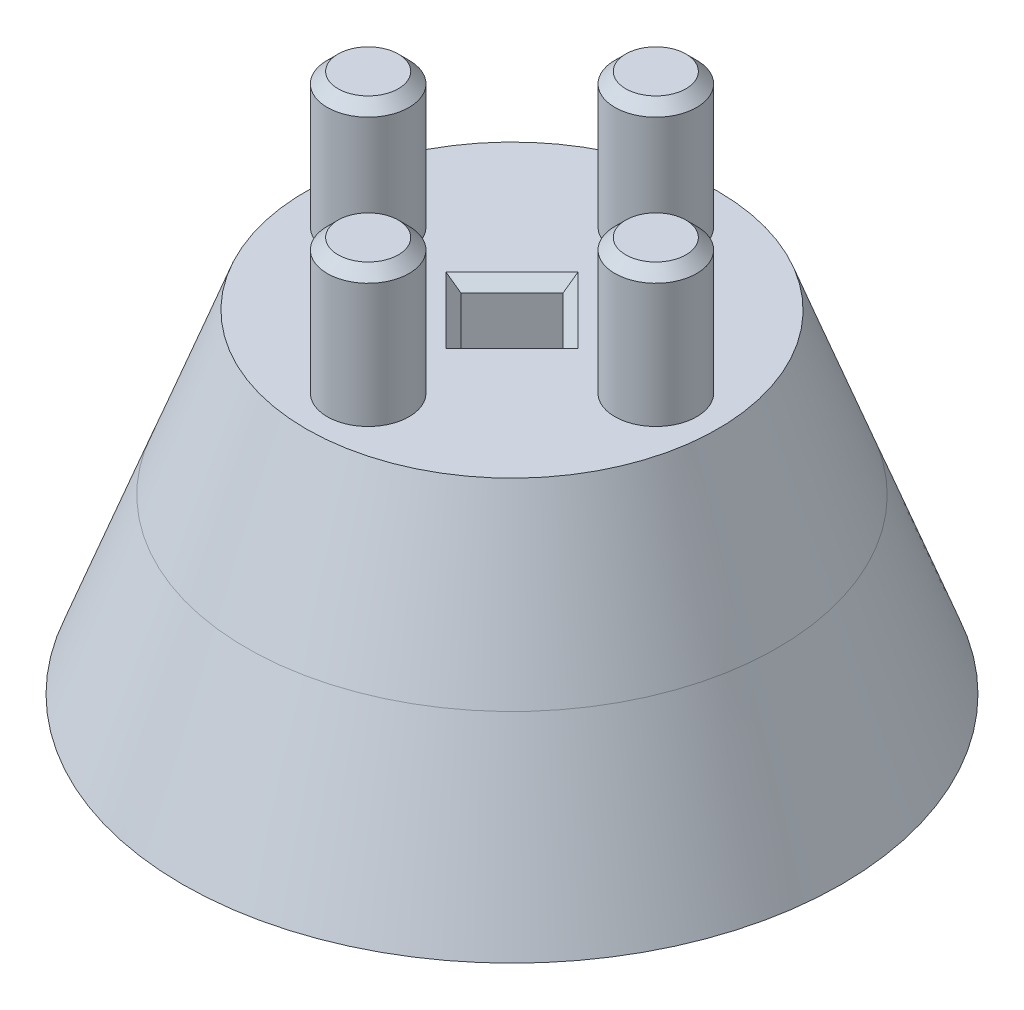
from build123d import *

# Parameters (mm, degrees)
CUT_EXTRUDE1_DEPTH  = 0.8
SKETCH3_R           = 21.299041780691258
SKETCH3_R_2         = 15
CUT_EXTRUDE2_DEPTH  = 1
CUT_EXTRUDE3_DEPTH  = 3.7
SKETCH4_3_R         = 2.6
CUT_EXTRUDE4_DEPTH  = 8.3
CUT_EXTRUDE5_DEPTH  = 28.928591200472848
SKETCH7_R           = 3.6000000000000014
SKETCH7_R_2         = 3.6
SKETCH7_R_3         = 3.5999999999999996
CUT_EXTRUDE6_DEPTH  = 1.5
SKETCH8_R           = 2.2750000000000004
SKETCH8_R_2         = 2.275
SKETCH8_R_3         = 2.2749999999999995
BOSS_EXTRUDE1_DEPTH = 7.5
CHAMFER1_SIZE       = 0.6
BOSS_EXTRUDE2_START = -0.2
SKETCH9_R           = 2.6
BOSS_EXTRUDE2_DEPTH = 0.2
CHAMFER2_SIZE       = 0.6
FILLET1_R           = 0.3
FILLET2_R           = 0.3
FILLET3_R           = 0.3
FILLET4_R           = 0.3
FILLET5_R           = 0.3


with BuildPart() as part:
    # Sketch1 → Revolve1 (revolve)
    with BuildSketch(Plane(origin=(0, 0, 0), x_dir=(0, 0, -1), z_dir=(1, 0, 0))):
        Polygon((0, 0), (0, 19.499999999999996), (11.45, 19.499999999999996), (18.7, 0), align=None)
    revolve(axis=Axis((0, 0, 0), (0, 1, 0)))

    # Sketch2 → Cut-Extrude1 (cut)
    with BuildSketch(Plane.XZ):
        with BuildLine():
            ThreePointArc((-4.999999999999996, 13.076696830622021), (-9.899494936611664, 9.899494936611665), (-13.07669683062202, 5.000000000000001))
            Line((-13.07669683062202, 5), (-4.9999999999999964, 5))
            Line((-4.999999999999997, 5), (-4.9999999999999964, 13.07669683062202))
        make_face()
        with BuildLine():
            Line((-4.000000000000001, 13.416407864998735), (-4.000000000000002, 5))
            Line((-4.000000000000002, 5), (4, 5))
            Line((4.000000000000002, 5), (4.000000000000001, 13.416407864998735))
            ThreePointArc((4.000000000000002, 13.416407864998735), (8.6e-16, 13.999999999999998), (-4.0000000000000036, 13.416407864998735))
        make_face()
        with BuildLine():
            Line((4.9999999999999964, 13.07669683062202), (4.999999999999997, 5))
            Line((4.9999999999999964, 5), (13.07669683062202, 5))
            ThreePointArc((13.07669683062202, 5), (9.899494936611662, 9.899494936611667), (4.999999999999997, 13.076696830622021))
        make_face()
        with BuildLine():
            Line((13.416407864998735, 4), (4.9999999999999964, 4))
            Line((4.999999999999997, 4), (4.999999999999999, -4))
            Line((5, -4), (13.416407864998728, -4))
            ThreePointArc((13.416407864998734, -4.000000000000007), (13.853333716293385, -2.021174150094161), (13.999999999999998, -3.43e-15))
            ThreePointArc((13.999999999999998, 0), (13.853333716293385, 2.021174150094156), (13.416407864998735, 4.000000000000001))
        make_face()
        Polygon((4.0000000000000036, 4), (-4.000000000000002, 4), (-4.0000000000000036, -4), (4.0000000000000036, -4), align=None)
        with BuildLine():
            Line((-4.9999999999999964, 4), (-13.416407864998735, 4))
            ThreePointArc((-13.416407864998734, 4.000000000000005), (-13.999999999999998, 1.71e-15), (-13.416407864998735, -4.000000000000003))
            Line((-13.416407864998728, -4), (-5, -4))
            Line((-4.999999999999999, -4), (-4.999999999999997, 4))
        make_face()
        with BuildLine():
            Line((-5, -5), (-13.076696830622012, -5))
            ThreePointArc((-13.076696830622017, -5.000000000000004), (-9.899494936611667, -9.899494936611664), (-5.000000000000008, -13.076696830622016))
            Line((-5, -13.07669683062202), (-4.999999999999999, -5))
        make_face()
        with BuildLine():
            Line((4.0000000000000036, -5), (-4.0000000000000036, -5))
            Line((-4.0000000000000036, -5), (-4.000000000000004, -13.416407864998735))
            ThreePointArc((-4.000000000000006, -13.416407864998734), (-2.57e-15, -13.999999999999998), (4.000000000000001, -13.416407864998735))
            Line((4.000000000000004, -13.416407864998735), (4.0000000000000036, -5))
        make_face()
        with BuildLine():
            Line((13.076696830622012, -5), (5, -5))
            Line((4.999999999999999, -5), (5, -13.07669683062202))
            ThreePointArc((5.0000000000000036, -13.076696830622017), (9.899494936611662, -9.899494936611667), (13.076696830622016, -5.000000000000009))
        make_face()
    extrude(amount=-CUT_EXTRUDE1_DEPTH, mode=Mode.SUBTRACT)

    # Sketch3 → Cut-Extrude2 (cut)
    with BuildSketch(Plane.XZ):
        Circle(SKETCH3_R)
        with Locations(Location((0, 0, 0), (0, 0, 270))):
            Circle(SKETCH3_R_2, mode=Mode.SUBTRACT)
    extrude(amount=-CUT_EXTRUDE2_DEPTH, mode=Mode.SUBTRACT)

    # Sketch4 → Cut-Extrude3 (cut)
    with BuildSketch(Plane.XZ.offset(-0.8)):
        with BuildLine():
            Line((-4.000000000000003, 5), (-0.5000000000001146, 5))
            Line((-0.5000000000001145, 5), (-0.5000000000001145, 6.434891306004865))
            ThreePointArc((-0.5000000000002117, 6.434891306004852), (-2.545584412271637, 7.454415587728494), (-3.5651086939951733, 9.499999999999972))
            Line((-3.5651086939951697, 9.5), (-4.000000000000004, 9.5))
            Line((-4.000000000000001, 9.5), (-4.000000000000003, 5))
        make_face()
        with BuildLine():
            Line((-0.5000000000001145, 13.565108693995134), (-0.5000000000001145, 13.991068579633216))
            ThreePointArc((-0.5000000000001135, 13.991068579633218), (-2.268272191390687, 13.815025923456087), (-4.000000000000001, 13.416407864998739))
            Line((-4, 13.416407864998737), (-4.000000000000001, 10.499999999999998))
            Line((-4.000000000000005, 10.499999999999998), (-3.5651086939951697, 10.499999999999998))
            ThreePointArc((-3.5651086939951737, 10.500000000000028), (-2.5455844122716376, 12.545584412271506), (-0.5000000000002139, 13.565108693995148))
        make_face()
        with BuildLine():
            Line((3.5651086939951835, 10.5), (3.999999999999991, 10.5))
            Line((4.000000000000002, 10.5), (4.000000000000001, 13.416407864998735))
            ThreePointArc((4.000000000000001, 13.416407864998735), (2.268272191390688, 13.815025923456083), (0.5000000000001148, 13.991068579633215))
            Line((0.5000000000001149, 13.991068579633216), (0.5000000000001149, 13.56510869399517))
            ThreePointArc((0.5000000000000878, 13.565108693995166), (2.54558441227161, 12.545584412271532), (3.565108693995181, 10.499999999999979))
        make_face()
        with BuildLine():
            Line((0.5000000000001146, 5), (4.000000000000003, 5))
            Line((4.000000000000003, 5), (4.000000000000002, 9.500000000000002))
            Line((3.999999999999992, 9.500000000000002), (3.5651086939951835, 9.500000000000002))
            ThreePointArc((3.565108693995181, 9.500000000000023), (2.5455844122716114, 7.4544155877284695), (0.5000000000000868, 6.434891306004834))
            Line((0.5000000000001149, 6.434891306004831), (0.5000000000001149, 5))
        make_face()
        with BuildLine():
            Line((4.999999999999998, 5), (13.07669683062202, 5))
            ThreePointArc((13.07669683062202, 5), (9.899494936611664, 9.899494936611665), (4.999999999999997, 13.076696830622021))
            Line((4.999999999999997, 13.076696830622021), (4.999999999999998, 5))
        make_face()
        with BuildLine():
            Line((-6.4348913060048165, 0.49999999999999656), (-4.999999999999998, 0.49999999999999656))
            Line((-4.999999999999998, 0.49999999999999645), (-4.999999999999998, 4))
            Line((-4.999999999999998, 4), (-9.500000000000002, 4))
            Line((-9.500000000000002, 3.999999999999991), (-9.500000000000002, 3.5651086939951817))
            ThreePointArc((-9.500000000000028, 3.565108693995178), (-7.454415587728431, 2.5455844122715705), (-6.434891306004819, 0.49999999999997563))
        make_face()
        with BuildLine():
            Line((-4.999999999999998, -4), (-4.999999999999998, -0.5000000000000173))
            Line((-4.999999999999998, -0.5000000000000173), (-6.434891306004819, -0.5000000000000173))
            ThreePointArc((-6.434891306004822, -0.4999999999999964), (-7.454415587728436, -2.5455844122715816), (-9.500000000000027, -3.5651086939951844))
            Line((-9.499999999999998, -3.565108693995188), (-9.499999999999998, -4.000000000000005))
            Line((-9.499999999999998, -3.9999999999999973), (-4.999999999999998, -4))
        make_face()
        with BuildLine():
            Line((-13.416407864998734, -3.9999999999999947), (-10.499999999999998, -3.9999999999999964))
            Line((-10.499999999999998, -4.000000000000006), (-10.499999999999998, -3.5651086939951537))
            ThreePointArc((-10.500000000000098, -3.565108693995167), (-12.545584412271591, -2.545584412271555), (-13.565108693995171, -0.5000000000000457))
            Line((-13.565108693995167, -0.5000000000000173), (-13.991068579633216, -0.5000000000000173))
            ThreePointArc((-13.991068579633218, -0.5000000000000172), (-13.815025923456089, -2.2682721913906367), (-13.416407864998734, -3.9999999999999933))
        make_face()
        with BuildLine():
            Line((-10.499999999999998, 3.565108693995147), (-10.499999999999998, 3.9999999999999902))
            Line((-10.499999999999998, 4), (-13.416407864998735, 4))
            ThreePointArc((-13.416407864998734, 3.9999999999999996), (-13.815025923456094, 2.268272191390629), (-13.99106857963322, 0.49999999999999745))
            Line((-13.991068579633216, 0.49999999999999656), (-13.56510869399517, 0.49999999999999656))
            ThreePointArc((-13.565108693995173, 0.5000000000000265), (-12.545584412271596, 2.5455844122715434), (-10.500000000000098, 3.565108693995161))
        make_face()
        Polygon((-0.5000000000001145, 3.7426406871191684), (-0.5000000000001145, 4), (-4.000000000000003, 4), (-4.000000000000003, 0.49999999999999645), (-3.742640687119284, 0.49999999999999656), align=None)
        Polygon((-3.7426406871192643, -0.5000000000000173), (-4.000000000000002, -0.5000000000000173), (-4.0000000000000036, -4), (-0.5000000000001146, -4), (-0.5000000000001145, -3.7426406871191755), align=None)
        Polygon((4.000000000000003, -4), (4.000000000000003, -0.5000000000000173), (3.742640687119275, -0.5000000000000173), (0.500000000000111, -3.7426406871191755), (0.5000000000001149, -3.9999999999999982), align=None)
        Polygon((4.000000000000003, 4), (0.500000000000115, 4), (0.5000000000001149, 3.7426406871191684), (3.742640687119293, 0.4999999999999934), (4.000000000000002, 0.49999999999999656), align=None)
        with BuildLine():
            Line((4.999999999999998, 4), (4.999999999999998, 0.49999999999999645))
            Line((4.999999999999998, 0.49999999999999656), (6.434891306004827, 0.49999999999999656))
            ThreePointArc((6.434891306004825, 0.5000000000000243), (7.454415587728401, 2.5455844122715443), (9.4999999999999, 3.565108693995164))
            Line((9.499999999999998, 3.5651086939951506), (9.499999999999998, 4.000000000000006))
            Line((9.499999999999998, 4), (4.999999999999998, 4))
        make_face()
        with BuildLine():
            Line((6.434891306004831, -0.5000000000000173), (4.999999999999998, -0.5000000000000173))
            Line((4.999999999999998, -0.5000000000000178), (4.999999999999998, -4))
            Line((4.999999999999998, -4), (9.500000000000002, -4))
            Line((9.500000000000002, -3.9999999999999902), (9.500000000000002, -3.5651086939951524))
            ThreePointArc((9.499999999999902, -3.5651086939951653), (7.454415587728409, -2.5455844122715536), (6.434891306004827, -0.5000000000000449))
        make_face()
        with BuildLine():
            Line((10.499999999999998, -3.565108693995187), (10.499999999999998, -3.9999999999999893))
            Line((10.499999999999998, -4), (13.416407864998728, -4))
            ThreePointArc((13.416407864998728, -3.9999999999999996), (13.815025923456087, -2.2682721913906385), (13.991068579633215, -0.5000000000000165))
            Line((13.991068579633216, -0.5000000000000173), (13.565108693995183, -0.5000000000000173))
            ThreePointArc((13.565108693995178, -0.49999999999999717), (12.545584412271563, -2.545584412271582), (10.49999999999997, -3.565108693995183))
        make_face()
        with BuildLine():
            Line((13.416407864998735, 4), (10.499999999999998, 4))
            Line((10.499999999999998, 4.000000000000007), (10.499999999999998, 3.5651086939951857))
            ThreePointArc((10.499999999999972, 3.565108693995182), (12.54558441227157, 2.545584412271573), (13.565108693995182, 0.49999999999997546))
            Line((13.565108693995183, 0.49999999999999656), (13.991068579633216, 0.49999999999999656))
            ThreePointArc((13.991068579633215, 0.49999999999999767), (13.81502592345609, 2.2682721913906287), (13.416407864998735, 4.000000000000001))
        make_face()
        with BuildLine():
            Line((4.999999999999998, -5), (5, -13.07669683062202))
            ThreePointArc((5, -13.07669683062202), (9.899494936611662, -9.899494936611667), (13.076696830622014, -5.000000000000008))
            Line((13.076696830622014, -5.000000000000008), (4.999999999999998, -5))
        make_face()
        with BuildLine():
            Line((4.000000000000003, -5), (0.500000000000115, -5))
            Line((0.5000000000001149, -4.999999999999998), (0.5000000000001149, -6.434891306004831))
            ThreePointArc((0.5000000000000878, -6.434891306004834), (2.5455844122716096, -7.454415587728468), (3.5651086939951804, -9.50000000000002))
            Line((3.565108693995183, -9.499999999999998), (4.000000000000005, -9.499999999999998))
            Line((4.0000000000000036, -9.499999999999998), (4.000000000000003, -5))
        make_face()
        with BuildLine():
            Line((-0.5000000000001145, -6.434891306004866), (-0.5000000000001145, -4.999999999999998))
            Line((-0.5000000000001146, -5), (-4.000000000000003, -5))
            Line((-4.000000000000003, -5), (-4.0000000000000036, -9.5))
            Line((-3.999999999999991, -9.5), (-3.5651086939951693, -9.5))
            ThreePointArc((-3.5651086939951733, -9.49999999999997), (-2.5455844122716367, -7.454415587728494), (-0.5000000000002139, -6.434891306004852))
        make_face()
        with BuildLine():
            Line((-3.56510869399517, -10.499999999999998), (-3.9999999999999902, -10.499999999999998))
            Line((-4.0000000000000036, -10.499999999999998), (-4.000000000000004, -13.416407864998735))
            ThreePointArc((-4.000000000000005, -13.416407864998739), (-2.2682721913906905, -13.815025923456089), (-0.5000000000001148, -13.991068579633222))
            Line((-0.5000000000001145, -13.991068579633216), (-0.5000000000001145, -13.565108693995134))
            ThreePointArc((-0.5000000000002117, -13.565108693995148), (-2.545584412271637, -12.545584412271506), (-3.5651086939951737, -10.500000000000025))
        make_face()
        with BuildLine():
            Line((4.000000000000004, -13.416407864998735), (4.0000000000000036, -10.499999999999996))
            Line((4.000000000000006, -10.499999999999996), (3.5651086939951835, -10.499999999999996))
            ThreePointArc((3.565108693995181, -10.499999999999977), (2.5455844122716114, -12.54558441227153), (0.5000000000000868, -13.565108693995166))
            Line((0.5000000000001149, -13.56510869399517), (0.5000000000001149, -13.991068579633216))
            ThreePointArc((0.5000000000001148, -13.991068579633222), (2.2682721913906914, -13.815025923456087), (4.000000000000006, -13.416407864998739))
        make_face()
        with BuildLine():
            Line((-4.999999999999998, -5), (-13.076696830622012, -5))
            ThreePointArc((-13.076696830622012, -5), (-9.899494936611664, -9.899494936611656), (-5.000000000000008, -13.076696830622014))
            Line((-5.000000000000008, -13.076696830622014), (-4.999999999999998, -5))
        make_face()
        with BuildLine():
            Line((-4.999999999999998, 5), (-4.9999999999999964, 13.07669683062202))
            ThreePointArc((-4.9999999999999964, 13.07669683062202), (-9.899494936611664, 9.899494936611665), (-13.07669683062202, 5.000000000000001))
            Line((-13.07669683062202, 5.000000000000001), (-4.999999999999998, 5))
        make_face()
    extrude(amount=-CUT_EXTRUDE3_DEPTH, mode=Mode.SUBTRACT)

    # Sketch4<3> → Cut-Extrude4 (cut)
    with BuildSketch(Plane.XZ.offset(-0.8)):
        with BuildLine():
            ThreePointArc((-2.551470164434615, 9.5), (-1.8384776310850754, 8.161522368915028), (-0.5000000000001429, 7.448529835565413))
            Line((-0.5000000000001145, 7.448529835565418), (-0.5000000000001145, 9.5))
            Line((-0.5000000000001146, 9.5), (-2.5514701644346145, 9.5))
        make_face()
        with BuildLine():
            Line((-2.5514701644346145, 9.5), (-0.5000000000001146, 9.5))
            Line((-0.5000000000001145, 9.5), (-0.5000000000001145, 10.499999999999998))
            Line((-0.5000000000001146, 10.499999999999998), (-2.551470164434615, 10.499999999999998))
            ThreePointArc((-2.551470164434615, 10.5), (-2.6, 10), (-2.551470164434615, 9.5))
        make_face()
        with BuildLine():
            Line((-2.551470164434615, 10.499999999999998), (-0.5000000000001146, 10.499999999999998))
            Line((-0.5000000000001145, 10.499999999999998), (-0.5000000000001145, 12.551470164434582))
            ThreePointArc((-0.5000000000001423, 12.551470164434587), (-1.8384776310850748, 11.838477631084972), (-2.551470164434615, 10.5))
        make_face()
        with BuildLine():
            Line((-0.5000000000001146, 10.499999999999998), (0.5000000000001146, 10.5))
            Line((0.5000000000001149, 10.5), (0.5000000000001149, 12.551470164434575))
            ThreePointArc((0.5000000000001635, 12.551470164434583), (1.113e-14, 12.6), (-0.5000000000001423, 12.551470164434587))
            Line((-0.5000000000001145, 12.551470164434582), (-0.5000000000001145, 10.499999999999998))
        make_face()
        with BuildLine():
            Line((0.5000000000001146, 10.5), (2.5514701644345994, 10.5))
            ThreePointArc((2.5514701644346074, 10.500000000000039), (1.8384776310850686, 11.838477631084979), (0.5000000000001635, 12.551470164434583))
            Line((0.5000000000001149, 12.551470164434575), (0.5000000000001149, 10.5))
        make_face()
        with BuildLine():
            Line((0.5000000000001146, 9.500000000000002), (2.5514701644346003, 9.500000000000002))
            ThreePointArc((2.5514701644346065, 9.49999999999996), (2.587839101212629, 9.748825187896932), (2.6, 10))
            ThreePointArc((2.6, 10), (2.587839101212629, 10.251174812103066), (2.5514701644346074, 10.500000000000039))
            Line((2.5514701644345994, 10.5), (0.5000000000001146, 10.5))
            Line((0.5000000000001149, 10.5), (0.5000000000001149, 9.500000000000002))
        make_face()
        Polygon((-0.5000000000001146, 9.5), (0.5000000000001146, 9.500000000000002), (0.5000000000001149, 10.5), (-0.5000000000001146, 10.499999999999998), align=None)
        with BuildLine():
            ThreePointArc((-0.5000000000001429, 7.448529835565413), (8.76e-15, 7.4), (0.5000000000001623, 7.448529835565417))
            Line((0.5000000000001149, 7.4485298355654255), (0.5000000000001149, 9.500000000000002))
            Line((0.5000000000001146, 9.500000000000002), (-0.5000000000001146, 9.5))
            Line((-0.5000000000001145, 9.5), (-0.5000000000001145, 7.448529835565418))
        make_face()
        with BuildLine():
            ThreePointArc((0.5000000000001623, 7.448529835565417), (1.8384776310850672, 8.16152236891502), (2.5514701644346065, 9.49999999999996))
            Line((2.5514701644346003, 9.500000000000002), (0.5000000000001146, 9.500000000000002))
            Line((0.5000000000001149, 9.500000000000002), (0.5000000000001149, 7.4485298355654255))
        make_face()
        with BuildLine():
            Line((10.499999999999998, 2.5514701644345963), (10.499999999999998, 0.49999999999999645))
            Line((10.499999999999998, 0.49999999999999656), (12.551470164434603, 0.49999999999999656))
            ThreePointArc((12.551470164434608, 0.5000000000000356), (11.838477631085027, 1.838477631085019), (10.500000000000048, 2.551470164434605))
        make_face()
        with BuildLine():
            Line((9.499999999999998, 2.551470164434604), (9.5, 0.49999999999999645))
            Line((9.499999999999998, 0.49999999999999656), (10.499999999999998, 0.49999999999999656))
            Line((10.499999999999998, 0.49999999999999645), (10.499999999999998, 2.5514701644345963))
            ThreePointArc((10.500000000000048, 2.551470164434605), (10.000000000000009, 2.5999999999999996), (9.49999999999997, 2.5514701644346087))
        make_face()
        with BuildLine():
            ThreePointArc((9.49999999999997, 2.5514701644346087), (8.161522368914966, 1.838477631085012), (7.448529835565385, 0.49999999999999833))
            Line((7.448529835565386, 0.49999999999999656), (9.499999999999998, 0.49999999999999656))
            Line((9.5, 0.49999999999999645), (9.499999999999998, 2.551470164434604))
        make_face()
        with BuildLine():
            Line((9.499999999999998, 0.49999999999999656), (7.448529835565386, 0.49999999999999656))
            ThreePointArc((7.448529835565385, 0.49999999999999833), (7.4, -9.41e-15), (7.448529835565388, -0.500000000000018))
            Line((7.448529835565386, -0.5000000000000173), (9.499999999999998, -0.5000000000000173))
            Line((9.5, -0.5000000000000169), (9.5, 0.49999999999999645))
        make_face()
        with BuildLine():
            Line((9.499999999999998, -0.5000000000000173), (7.448529835565386, -0.5000000000000173))
            ThreePointArc((7.448529835565388, -0.500000000000018), (8.161522368914973, -1.8384776310850204), (9.499999999999973, -2.55147016443461))
            Line((9.500000000000002, -2.5514701644346056), (9.5, -0.5000000000000169))
        make_face()
        with BuildLine():
            Line((10.499999999999998, -0.5000000000000173), (9.499999999999998, -0.5000000000000173))
            Line((9.5, -0.5000000000000169), (9.500000000000002, -2.5514701644346056))
            ThreePointArc((9.499999999999973, -2.55147016443461), (10.000000000000009, -2.6000000000000005), (10.500000000000046, -2.551470164434606))
            Line((10.499999999999998, -2.5514701644345976), (10.499999999999998, -0.5000000000000178))
        make_face()
        with BuildLine():
            Line((12.551470164434596, -0.5000000000000173), (10.499999999999998, -0.5000000000000173))
            Line((10.499999999999998, -0.5000000000000178), (10.499999999999998, -2.5514701644345976))
            ThreePointArc((10.500000000000046, -2.551470164434606), (11.838477631085018, -1.8384776310850295), (12.551470164434603, -0.5000000000000596))
        make_face()
        Polygon((10.499999999999998, 0.49999999999999656), (9.499999999999998, 0.49999999999999656), (9.5, -0.5000000000000169), (10.499999999999998, -0.5000000000000173), align=None)
        with BuildLine():
            Line((12.551470164434603, 0.49999999999999656), (10.499999999999998, 0.49999999999999656))
            Line((10.499999999999998, 0.49999999999999645), (10.499999999999998, -0.5000000000000178))
            Line((10.499999999999998, -0.5000000000000173), (12.551470164434596, -0.5000000000000173))
            ThreePointArc((12.551470164434603, -0.5000000000000596), (12.587839101212628, -0.25117481210307757), (12.6, -1.13e-15))
            ThreePointArc((12.6, -4.9e-16), (12.58783910121263, 0.2511748121030646), (12.551470164434608, 0.5000000000000357))
        make_face()
        with Locations(Location((0, -10, 0), (0, 0, 270))):
            Circle(SKETCH4_3_R)
        with Locations(Location((-10, -2.94e-15, 0), (0, 0, 270))):
            Circle(SKETCH4_3_R)
        Polygon((0, 2.82842712474619), (-2.82842712474619, 0), (8.7e-16, -2.8284271247461903), (2.828427124746191, -4.3e-16), align=None)
    extrude(amount=-CUT_EXTRUDE4_DEPTH, mode=Mode.SUBTRACT)

    # Sketch6 → Cut-Extrude5 (cut, through all)
    with BuildSketch(Plane.XZ.offset(-9.1)):
        Polygon((2.828427124746191, -4.3e-16), (0, 2.82842712474619), (-2.82842712474619, 0), (8.7e-16, -2.8284271247461903), align=None)
    extrude(amount=-CUT_EXTRUDE5_DEPTH, mode=Mode.SUBTRACT)

    # Sketch7 → Cut-Extrude6 (cut)
    with BuildSketch(Plane.XZ.offset(-9.1)):
        with Locations(Location((10, -4.9e-16, 0), (0, 0, 270))):
            Circle(SKETCH7_R)
        with Locations(Location((0, 10, 0), (0, 0, 270))):
            Circle(SKETCH7_R_2)
        with Locations(Location((-10, -2.94e-15, 0), (0, 0, 270))):
            Circle(SKETCH7_R_3)
        with Locations(Location((0, -10, 0), (0, 0, 270))):
            Circle(SKETCH7_R_2)
    extrude(amount=-CUT_EXTRUDE6_DEPTH, mode=Mode.SUBTRACT)


with BuildPart() as body_2:
    # Split1: the piece on the far side of the plane
    add(part.part)
    split(bisect_by=Plane(origin=(0, 10.6, 0), x_dir=(0, 0, -1), z_dir=(0, -1, 0)), keep=Keep.BOTTOM)

    # Sketch8 → Boss-Extrude1 (add)
    with BuildSketch(Plane(origin=(0, 19.499999999999996, 0), x_dir=(1, 0, 0), z_dir=(0, 1, 0))):
        with Locations(Location((0, 8, 0), (0, 0, 270))):
            Circle(SKETCH8_R)
        with Locations(Location((-8, 0, 0), (0, 0, 270))):
            Circle(SKETCH8_R_2)
        with Locations(Location((8, 0, 0), (0, 0, 270))):
            Circle(SKETCH8_R_3)
        with Locations(Location((0, -8, 0), (0, 0, 270))):
            Circle(SKETCH8_R_2)
    extrude(amount=BOSS_EXTRUDE1_DEPTH)

    # Chamfer1
    chamfer1_edges = [body_2.edges().sort_by_distance(p)[0] for p in [
        (7e-16, 26.999999999999996, -10.275),
        (-7.999999999999999, 26.999999999999996, -2.275),
        (8, 26.999999999999996, -2.2749999999999995),
        (7e-16, 26.999999999999996, 5.725),
        (1.4142135623730958, 19.499999999999996, -1.4142135623730954),
        (1.4142135623730951, 19.499999999999996, 1.414213562373095),
        (-1.4142135623730951, 19.5, 1.414213562373095),
        (-1.4142135623730945, 19.499999999999996, -1.4142135623730954),
        (1.4142135623730951, 10.6, 1.414213562373095),
        (1.4142135623730958, 10.6, -1.4142135623730954),
        (-1.4142135623730945, 10.6, -1.4142135623730954),
        (-1.4142135623730951, 10.6, 1.414213562373095),
    ]]
    chamfer(chamfer1_edges, length=CHAMFER1_SIZE)


with BuildPart() as part_1:
    add(part.part)

    # Split1
    split(bisect_by=Plane(origin=(0, 10.6, 0), x_dir=(0, 0, -1), z_dir=(0, -1, 0)), keep=Keep.TOP)

    # Sketch9 → Boss-Extrude2 (add)
    with BuildSketch(Plane(origin=(0, 9.1, 0), x_dir=(1, 0, 0), z_dir=(0, 1, 0)).offset(BOSS_EXTRUDE2_START)):
        with Locations(Location((0, -10, 0), (0, 0, 90))):
            Circle(SKETCH9_R)
        with Locations(Location((-10, 2.94e-15, 0), (0, 0, 90))):
            Circle(SKETCH9_R)
        with Locations(Location((0, 10, 0), (0, 0, 90))):
            Circle(SKETCH9_R)
        with Locations(Location((10, 4.9e-16, 0), (0, 0, 90))):
            Circle(SKETCH9_R)
    extrude(amount=BOSS_EXTRUDE2_DEPTH)

    # Chamfer2
    chamfer2_edges = [part_1.edges().sort_by_distance(p)[0] for p in [
        (-1.4142135623730951, 10.6, 1.414213562373095),
        (-1.4142135623730945, 10.6, -1.4142135623730954),
        (1.4142135623730958, 10.6, -1.4142135623730954),
        (1.4142135623730951, 10.6, 1.414213562373095),
    ]]
    chamfer(chamfer2_edges, length=CHAMFER2_SIZE)

    # Fillet1
    fillet1_edges = [part_1.edges().sort_by_distance(p)[0] for p in [
        (13.07669683062202, 2.25, 5),
        (4.999999999999997, 2.25, 5),
        (4.9999999999999964, 2.25, 13.076696830622021),
        (-13.076696830622014, 2.25, -5.000000000000002),
        (-4.999999999999999, 2.25, -5),
        (-5.000000000000007, 2.25, -13.076696830622017),
        (5.000000000000001, 2.25, -13.07669683062202),
        (4.999999999999999, 2.25, -5),
        (13.076696830622016, 2.25, -5.000000000000006),
        (-4.9999999999999964, 2.25, 13.07669683062202),
        (-4.999999999999997, 2.25, 5),
        (-13.07669683062202, 2.25, 5.000000000000002),
    ]]
    fillet(fillet1_edges, radius=FILLET1_R)

    # Fillet2
    fillet2_edges = [part_1.edges().sort_by_distance(p)[0] for p in [
        (3.7426406871192945, 2.6500000000000004, 0.499999999999995),
        (0.5000000000001166, 2.6500000000000004, 3.7426406871191684),
        (0.500000000000113, 2.6500000000000004, -3.7426406871191755),
        (3.7426406871192732, 2.6500000000000004, -0.5000000000000162),
        (-0.5000000000001126, 2.6500000000000004, -3.7426406871191746),
        (-3.7426406871192652, 2.6500000000000004, -0.500000000000018),
        (-0.5000000000001152, 2.6500000000000004, 3.7426406871191684),
        (-3.7426406871192843, 2.6500000000000004, 0.4999999999999983),
        (-4.0000000000000036, 2.6500000000000004, 10.499999999999998),
        (-0.500000000000114, 2.6500000000000004, 13.991068579633218),
        (0.5000000000001148, 2.6500000000000004, 13.991068579633218),
        (3.9999999999999964, 2.6500000000000004, 10.5),
        (0.5000000000001011, 2.6500000000000004, 6.4348913060048325),
        (3.999999999999997, 2.6500000000000004, 9.500000000000002),
        (0.5000000000001148, 2.6500000000000004, 5),
        (4.000000000000002, 2.25, 5),
        (-4.000000000000002, 2.25, 5),
        (4.000000000000005, 2.6500000000000004, -10.499999999999996),
        (0.5000000000001149, 2.6500000000000004, -13.991068579633218),
        (-0.5000000000001148, 2.6500000000000004, -13.991068579633218),
        (-3.999999999999997, 2.6500000000000004, -10.499999999999998),
        (-0.5000000000001643, 2.6500000000000004, -6.434891306004859),
        (-3.9999999999999973, 2.6500000000000004, -9.5),
        (-0.5000000000001146, 2.6500000000000004, -4.999999999999999),
        (0.5000000000001014, 2.6500000000000004, -6.4348913060048325),
        (0.500000000000115, 2.6500000000000004, -4.999999999999999),
        (4.000000000000004, 2.6500000000000004, -9.499999999999998),
        (-0.5000000000001631, 2.6500000000000004, 6.434891306004859),
        (-0.5000000000001146, 2.6500000000000004, 5),
        (-4.000000000000003, 2.6500000000000004, 9.5),
    ]]
    fillet(fillet2_edges, radius=FILLET2_R)

    # Fillet3
    fillet3_edges = [part_1.edges().sort_by_distance(p)[0] for p in [
        (10.499999999999998, 2.6500000000000004, 4.0000000000000036),
        (13.991068579633215, 2.6500000000000004, 0.4999999999999971),
        (13.991068579633218, 2.6500000000000004, -0.5000000000000169),
        (10.499999999999998, 2.6500000000000004, -3.9999999999999947),
        (6.434891306004829, 2.6500000000000004, -0.5000000000000309),
        (9.500000000000002, 2.6500000000000004, -3.999999999999995),
        (4.999999999999998, 2.6500000000000004, -0.5000000000000175),
        (6.434891306004826, 2.6500000000000004, 0.5000000000000104),
        (4.999999999999998, 2.6500000000000004, 0.4999999999999965),
        (9.499999999999998, 2.6500000000000004, 4.0000000000000036),
        (-13.991068579633218, 2.6500000000000004, 0.49999999999999695),
        (-10.499999999999998, 2.6500000000000004, 3.999999999999995),
        (-10.499999999999998, 2.6500000000000004, -4.000000000000002),
        (-13.991068579633218, 2.6500000000000004, -0.5000000000000173),
        (-6.43489130600482, 2.6500000000000004, -0.5000000000000069),
        (-4.999999999999998, 2.6500000000000004, -0.5000000000000173),
        (-9.499999999999998, 2.6500000000000004, -4.000000000000002),
        (-6.434891306004818, 2.6500000000000004, 0.4999999999999862),
        (-9.500000000000002, 2.6500000000000004, 3.9999999999999956),
        (-4.999999999999998, 2.6500000000000004, 0.4999999999999965),
    ]]
    fillet(fillet3_edges, radius=FILLET3_R)

    # Fillet4
    # the kernel refuses this fillet: 0.3 mm, written as the material it adds along each edge
    with BuildSketch(Plane(origin=(9.499999999999952, 0.8, -3.5651086939951586), x_dir=(3.5556e-13, 0, -1), z_dir=(0, 1, 0))) as fillet4_piece_1:
        with BuildLine():
            CenterArc((0.25734098550218165, 0.27387237171901635), FILLET4_R, 191.44509533034562, 54.4652521334346)
            Line((-0.03669360522836911, 0.21434372774052984), (-0.04257429704297995, 0.21315315486096062))
            ThreePointArc((-0.04257429704297995, 0.21315315486096062), (-0.02264194348097535, 0.10643657665179956), (-0.005941847823325, -0.00083333333333469))
            Line((-0.005941847823325, -0.00083333333333469), (2.13e-15, -0.00600000000000023))
            ThreePointArc((2.13e-15, -0.00600000000000023), (0.06744565300242336, -0.00600000000002598), (0.13244231241489562, -0.00547744743438104))
            Line((0.13244231241489562, -0.00547744743438104), (0.13489130600484245, 0))
        make_face()
    extrude(amount=4.243654613968981)
    with BuildSketch(Plane(origin=(10.499999999999984, 0.8, -3.5651086939951853), x_dir=(0.985661310660605, 0, 0.16873583101054226), z_dir=(0, 1, 0))) as fillet4_piece_2:
        with BuildLine():
            CenterArc((0.22652275582047254, 0.2998631352896731), FILLET4_R, 213.80397827418142, 54.46525213343466)
            Line((-0.02276099661480419, 0.13295714147343018), (-0.02774667166351041, 0.12961902159710517))
            ThreePointArc((-0.02774667166351041, 0.12961902159710517), (-0.01729446617135982, 0.06546615575065284), (-0.00591396786396385, -0.00101241498606329))
            Line((-0.00591396786396385, -0.00101241498606329), (0.00018121820465722, -0.00599726270579333))
            ThreePointArc((0.00018121820465722, -0.00599726270579333), (0.1087309227938315, -0.00435762347607877), (0.21728062738300397, -0.0059972627057932))
            Line((0.21728062738300397, -0.0059972627057932), (0.21746184558765977, 0))
        make_face()
    extrude(amount=4.24365461396915)
    with BuildSketch(Plane(origin=(13.565108693995182, 0.8, -0.5000000000000072), x_dir=(-0.1670356255158843, 0, -0.985950860747389), z_dir=(0, 1, 0))) as fillet4_piece_3:
        with BuildLine():
            CenterArc((0.21359318824959622, -0.29987831652170854), FILLET4_R, 91.63195241483183, 49.08852178944221)
            Line((-0.01862675997359392, -0.10994702461008386), (-0.02327115893805757, -0.10614839877185057))
            ThreePointArc((-0.02327115893805757, -0.10614839877185057), (-0.01522908515149616, -0.05397129855191113), (-0.00591570516448434, 0.00100221375309531))
            Line((-0.00591570516448434, 0.00100221375309531), (0.00017087455059968, 0.00599756633043327))
            ThreePointArc((0.00017087455059968, 0.00599756633043327), (0.10252473035981019, 0.00453979826049311), (0.20487858616902063, 0.0059975663304341))
            Line((0.20487858616902063, 0.0059975663304341), (0.20504946071962013, 1e-17))
        make_face()
    extrude(amount=4.21262365179905)
    with BuildSketch(Plane(origin=(13.565108693995182, 0.8, 0.4999999999999859), x_dir=(-0.16703562551585957, 0, 0.9859508607473932), z_dir=(0, 1, 0))) as fillet4_piece_4:
        with BuildLine():
            CenterArc((0.2135931882496007, 0.29987831652170804), FILLET4_R, 219.27952579572525, 49.08852178944176)
            Line((-0.01862675997359233, 0.10994702461008594), (-0.02327115893805608, 0.10614839877185277))
            ThreePointArc((-0.02327115893805608, 0.10614839877185277), (-0.01522908515149426, 0.0539712985519116), (-0.00591570516448436, -0.00100221375309516))
            Line((-0.00591570516448436, -0.00100221375309516), (0.00017087455059988, -0.00599756633043502))
            ThreePointArc((0.00017087455059988, -0.00599756633043502), (0.10252473035980876, -0.00453979826049051), (0.20487858616901894, -0.00599756633043409))
            Line((0.20487858616901894, -0.00599756633043409), (0.20504946071961858, 0))
        make_face()
    extrude(amount=4.2126236517990465)
    with BuildSketch(Plane(origin=(9.49999999999995, 0.8, 3.5651086939951577), x_dir=(-0.9856613106606169, 0, -0.16873583101047274), z_dir=(0, 1, 0))) as fillet4_piece_5:
        with BuildLine():
            CenterArc((0.22652275582042972, 0.29986313528967273), FILLET4_R, 213.80397827417707, 54.46525213343466)
            Line((-0.02276099661485906, 0.13295714147344917), (-0.02774667166356552, 0.1296190215971245))
            ThreePointArc((-0.02774667166356552, 0.1296190215971245), (-0.01729446617141888, 0.06546615575065759), (-0.00591396786396393, -0.00101241498606287))
            Line((-0.00591396786396393, -0.00101241498606287), (0.0001812182046568, -0.00599726270579335))
            ThreePointArc((0.0001812182046568, -0.00599726270579335), (0.1087309227937979, -0.00435762347607096), (0.21728062738293785, -0.00599726270579319))
            Line((0.21728062738293785, -0.00599726270579319), (0.21746184558759404, 0))
        make_face()
    extrude(amount=4.243654613968986)
    with BuildSketch(Plane(origin=(10.499999999999986, 0.8, 3.565108693995184), x_dir=(1.0535e-13, 0, 1), z_dir=(0, 1, 0))) as fillet4_piece_6:
        with BuildLine():
            CenterArc((0.2573409855022817, 0.27387237171895995), FILLET4_R, 191.44509533031922, 54.465252133434774)
            Line((-0.03669360522829652, 0.21434372774060892), (-0.04257429704290791, 0.21315315486104242))
            ThreePointArc((-0.04257429704290791, 0.21315315486104242), (-0.02264194348094584, 0.10643657665183842), (-0.00594184782332538, -0.00083333333333195))
            Line((-0.00594184782332538, -0.00083333333333195), (-6.3e-16, -0.00600000000000023))
            ThreePointArc((-6.3e-16, -0.00600000000000023), (0.06744565300240771, -0.0059999999999949), (0.13244231241486779, -0.00547744743437991))
            Line((0.13244231241486779, -0.00547744743437991), (0.13489130600481714, 0))
        make_face()
    extrude(amount=4.243654613969145)
    with BuildSketch(Plane(origin=(3.5651086939951826, 0.8, 10.49999999999999), x_dir=(-0.16873583101053505, 0, 0.9856613106606064), z_dir=(0, 1, 0))) as fillet4_piece_7:
        with BuildLine():
            CenterArc((0.22652275582047265, 0.29986313528967334), FILLET4_R, 213.80397827418037, 54.465252133435)
            Line((-0.02276099661480754, 0.1329571414734346), (-0.02774667166351379, 0.12961902159710958))
            ThreePointArc((-0.02774667166351379, 0.12961902159710958), (-0.01729446617136329, 0.06546615575065501), (-0.00591396786396386, -0.00101241498606325))
            Line((-0.00591396786396386, -0.00101241498606325), (0.00018121820465717, -0.00599726270579333))
            ThreePointArc((0.00018121820465717, -0.00599726270579333), (0.10873092279382943, -0.00435762347607812), (0.21728062738300008, -0.0059972627057932))
            Line((0.21728062738300008, -0.0059972627057932), (0.2174618455876559, 0))
        make_face()
    extrude(amount=4.24365461396914)
    with BuildSketch(Plane(origin=(3.5651086939951826, 0.8, 9.500000000000012), x_dir=(1, 0, -9.218e-14), z_dir=(0, 1, 0))) as fillet4_piece_8:
        with BuildLine():
            CenterArc((0.2573409855022785, 0.27387237171896334), FILLET4_R, 191.44509533031996, 54.4652521334354)
            Line((-0.0366936052282989, 0.21434372774060845), (-0.04257429704291027, 0.21315315486104183))
            ThreePointArc((-0.04257429704291027, 0.21315315486104183), (-0.02264194348094724, 0.10643657665183989), (-0.00594184782332537, -0.00083333333333203))
            Line((-0.00594184782332537, -0.00083333333333203), (-5.5e-16, -0.00600000000000023))
            ThreePointArc((-5.5e-16, -0.00600000000000023), (0.06744565300240957, -0.00599999999999579), (0.13244231241487098, -0.00547744743437994))
            Line((0.13244231241487098, -0.00547744743437994), (0.13489130600482024, 0))
        make_face()
    extrude(amount=4.243654613969144)
    with BuildSketch(Plane(origin=(-3.565108693995172, 0.8, 9.499999999999986), x_dir=(0.16873583101051104, 0, -0.9856613106606104), z_dir=(0, 1, 0))) as fillet4_piece_9:
        with BuildLine():
            CenterArc((0.22652275582045558, 0.2998631352896731), FILLET4_R, 213.8039782741787, 54.465252133435285)
            Line((-0.02276099661482894, 0.13295714147344215), (-0.02774667166353527, 0.1296190215971173))
            ThreePointArc((-0.02774667166353527, 0.1296190215971173), (-0.01729446617138711, 0.06546615575065648), (-0.00591396786396389, -0.0010124149860631))
            Line((-0.00591396786396389, -0.0010124149860631), (0.00018121820465703, -0.00599726270579334))
            ThreePointArc((0.00018121820465703, -0.00599726270579334), (0.10873092279381585, -0.00435762347607586), (0.21728062738297557, -0.0059972627057932))
            Line((0.21728062738297557, -0.0059972627057932), (0.21746184558763157, 0))
        make_face()
    extrude(amount=4.243654613969079)
    with BuildSketch(Plane(origin=(-3.565108693995172, 0.8, 10.500000000000014), x_dir=(0.16873583101050643, 0, 0.9856613106606111), z_dir=(0, 1, 0))) as fillet4_piece_10:
        with BuildLine():
            CenterArc((0.22652275582045325, -0.29986313528967273), FILLET4_R, 91.73076959238597, 54.465252133435314)
            Line((-0.02276099661483174, -0.13295714147344123), (-0.02774667166353809, -0.12961902159711639))
            ThreePointArc((-0.02774667166353809, -0.12961902159711639), (-0.01729446617138855, -0.06546615575065626), (-0.00591396786396389, 0.00101241498606308))
            Line((-0.00591396786396389, 0.00101241498606308), (0.000181218204657, 0.00599726270579334))
            ThreePointArc((0.000181218204657, 0.00599726270579334), (0.10873092279381576, 0.00435762347607593), (0.21728062738297357, 0.0059972627057932))
            Line((0.21728062738297357, 0.0059972627057932), (0.21746184558762957, 0))
        make_face()
    extrude(amount=4.243654613969074)
    with BuildSketch(Plane(origin=(0.5000000000001015, 0.8, 13.565108693995167), x_dir=(4.119765587946474e-12, 0, 1.0), z_dir=(0, 1, 0))) as fillet4_piece_11:
        with BuildLine():
            CenterArc((0.2599876124899218, 0.2606827499822643), FILLET4_R, 191.24746097498777, 49.08852178944409)
            Line((-0.03425056493216716, 0.20216869229244283), (-0.0401353284806089, 0.2009984111386464))
            ThreePointArc((-0.0401353284806089, 0.2009984111386464), (-0.02160130046863941, 0.10032603810408265), (-0.00594184782332784, -0.00083333333330904))
            Line((-0.00594184782332784, -0.00083333333330904), (-2.472e-14, -0.00600000000000001))
            ThreePointArc((-2.472e-14, -0.00600000000000001), (0.05575684802720475, -0.00600000000021628), (0.10854421772575212, -0.0052136549996453))
            Line((0.10854421772575212, -0.0052136549996453), (0.11151369605446071, 0))
        make_face()
    extrude(amount=4.2126236517990625)
    with BuildSketch(Plane(origin=(-0.5000000000001641, 0.8, 13.56510869399514), x_dir=(-0.9859508607473981, 0, -0.16703562551583043), z_dir=(0, 1, 0))) as fillet4_piece_12:
        with BuildLine():
            CenterArc((0.21359318824955967, 0.2998783165217077), FILLET4_R, 219.27952579571894, 49.088521789444485)
            Line((-0.01862675997365369, 0.10994702461011158), (-0.02327115893811806, 0.10614839877188025))
            ThreePointArc((-0.02327115893811806, 0.10614839877188025), (-0.01522908515155507, 0.0539712985519195), (-0.00591570516448439, -0.00100221375309498))
            Line((-0.00591570516448439, -0.00100221375309498), (0.00017087455059908, -0.00599756633043333))
            ThreePointArc((0.00017087455059908, -0.00599756633043333), (0.10252473035977876, -0.00453979826048418), (0.20487858616895863, -0.00599756633043412))
            Line((0.20487858616895863, -0.00599756633043412), (0.20504946071955865, 0))
        make_face()
    extrude(amount=4.212623651798896)
    with BuildSketch(Plane(origin=(-10.500000000000048, 0.8, -3.5651086939951604), x_dir=(-0.985661310660618, 0, 0.16873583101046616), z_dir=(0, 1, 0))) as fillet4_piece_13:
        with BuildLine():
            CenterArc((0.22652275582042794, -0.2998631352896724), FILLET4_R, 91.73076959238831, 54.465252133434106)
            Line((-0.02276099661485947, -0.1329571414734464), (-0.02774667166356596, -0.12961902159712177))
            ThreePointArc((-0.02774667166356596, -0.12961902159712177), (-0.01729446617141989, -0.06546615575065565), (-0.00591396786396393, 0.00101241498606284))
            Line((-0.00591396786396393, 0.00101241498606284), (0.00018121820465676, 0.00599726270579335))
            ThreePointArc((0.00018121820465676, 0.00599726270579335), (0.10873092279379605, 0.00435762347607155), (0.21728062738293574, 0.00599726270579319))
            Line((0.21728062738293574, 0.00599726270579319), (0.21746184558759202, 0))
        make_face()
    extrude(amount=4.24365461396898)
    with BuildSketch(Plane(origin=(-9.500000000000012, 0.8, -3.565108693995186), x_dir=(1.1852e-13, 0, -1), z_dir=(0, 1, 0))) as fillet4_piece_14:
        with BuildLine():
            CenterArc((0.2573409855022853, -0.27387237171895656), FILLET4_R, 114.08965253624737, 54.46525213343418)
            Line((-0.0366936052282937, -0.21434372774060942), (-0.0425742970429051, -0.21315315486104297))
            ThreePointArc((-0.0425742970429051, -0.21315315486104297), (-0.02264194348094443, -0.10643657665184049), (-0.0059418478233254, 0.00083333333333187))
            Line((-0.0059418478233254, 0.00083333333333187), (-7.1e-16, 0.00600000000000023))
            ThreePointArc((-7.1e-16, 0.00600000000000023), (0.0674456530024063, 0.00599999999999401), (0.13244231241486507, 0.00547744743437988))
            Line((0.13244231241486507, 0.00547744743437988), (0.13489130600481447, 0))
        make_face()
    extrude(amount=4.243654613969145)
    with BuildSketch(Plane(origin=(-13.56510869399517, 0.8, -0.5000000000000315), x_dir=(-1.0, 0, -3.859915704318083e-12), z_dir=(0, 1, 0))) as fillet4_piece_15:
        with BuildLine():
            CenterArc((0.2599876124898718, -0.26068274998229335), FILLET4_R, 119.66401723555681, 49.088521789442254)
            Line((-0.03425056493220371, -0.2021686922924044), (-0.04013532848064515, -0.20099841113860667))
            ThreePointArc((-0.04013532848064515, -0.20099841113860667), (-0.02160130046865305, -0.10032603810406349), (-0.00594184782332762, 0.00083333333331042))
            Line((-0.00594184782332762, 0.00083333333331042), (-2.316e-14, 0.00600000000000001))
            ThreePointArc((-2.316e-14, 0.00600000000000001), (0.05575684802720808, 0.00600000000022943), (0.10854421772575348, 0.00521365499964585))
            Line((0.10854421772575348, 0.00521365499964585), (0.11151369605446249, 0))
        make_face()
    extrude(amount=4.212623651798983)
    with BuildSketch(Plane(origin=(-13.565108693995171, 0.8, 0.5000000000000115), x_dir=(-1.0, 0, 3.8658892648613246e-12), z_dir=(0, 1, 0))) as fillet4_piece_16:
        with BuildLine():
            CenterArc((0.2599876124898751, 0.2606827499822909), FILLET4_R, 191.2474609750004, 49.0885217894417)
            Line((-0.03425056493220072, 0.20216869229240472), (-0.04013532848064217, 0.200998411138607))
            ThreePointArc((-0.04013532848064217, 0.200998411138607), (-0.02160130046865067, 0.10032603810406317), (-0.00594184782332763, -0.00083333333331038))
            Line((-0.00594184782332763, -0.00083333333331038), (-2.32e-14, -0.00600000000000001))
            ThreePointArc((-2.32e-14, -0.00600000000000001), (0.05575684802720627, -0.00600000000023054), (0.10854421772575168, -0.00521365499964583))
            Line((0.10854421772575168, -0.00521365499964583), (0.11151369605446071, 0))
        make_face()
    extrude(amount=4.212623651798983)
    with BuildSketch(Plane(origin=(-9.500000000000014, 0.8, 3.565108693995179), x_dir=(1.0535e-13, 0, 1), z_dir=(0, 1, 0))) as fillet4_piece_17:
        with BuildLine():
            CenterArc((0.2573409855022808, 0.2738723717189635), FILLET4_R, 191.44509533031922, 54.46525213343614)
            Line((-0.03669360522829741, 0.21434372774061247), (-0.0425742970429088, 0.21315315486104597))
            ThreePointArc((-0.0425742970429088, 0.21315315486104597), (-0.02264194348094628, 0.1064365766518402), (-0.00594184782332538, -0.00083333333333195))
            Line((-0.00594184782332538, -0.00083333333333195), (-6.3e-16, -0.00600000000000023))
            ThreePointArc((-6.3e-16, -0.00600000000000023), (0.06744565300241082, -0.0059999999999949), (0.13244231241487311, -0.00547744743437991))
            Line((0.13244231241487311, -0.00547744743437991), (0.13489130600482246, 0))
        make_face()
    extrude(amount=4.243654613969154)
    with BuildSketch(Plane(origin=(-10.500000000000048, 0.8, 3.5651086939951537), x_dir=(-0.9856613106606172, 0, -0.16873583101047077), z_dir=(0, 1, 0))) as fillet4_piece_18:
        with BuildLine():
            CenterArc((0.2265227558204285, 0.29986313528967246), FILLET4_R, 213.80397827417627, 54.46525213343568)
            Line((-0.0227609966148629, 0.1329571414734521), (-0.02774667166356936, 0.12961902159712746))
            ThreePointArc((-0.02774667166356936, 0.12961902159712746), (-0.01729446617142073, 0.06546615575065863), (-0.00591396786396393, -0.00101241498606286))
            Line((-0.00591396786396393, -0.00101241498606286), (0.00018121820465678, -0.00599726270579335))
            ThreePointArc((0.00018121820465678, -0.00599726270579335), (0.108730922793796, -0.00435762347607061), (0.21728062738293774, -0.00599726270579319))
            Line((0.21728062738293774, -0.00599726270579319), (0.217461845587594, 0))
        make_face()
    extrude(amount=4.243654613968985)

    # Fillet5
    # the kernel refuses this fillet: 0.3 mm, written as the material it adds along each edge
    with BuildSketch(Plane(origin=(0.500000000000115, 0.8, 4), x_dir=(1, 0, 0), z_dir=(0, 1, 0))) as fillet5_piece_1:
        with BuildLine():
            CenterArc((0.24928458131455855, 0.2999999999999998), FILLET5_R, 213.80369373410792, 56.196306265892076)
            Line((2.9599e-13, 0.13309524416909824), (-0.00498569162598927, 0.12975714905248026))
            ThreePointArc((-0.00498569162598927, 0.12975714905248026), (-0.00600000000000012, 0.06654762208454912), (-0.00600000000000001, 0))
            Line((-0.00600000000000001, 0), (0, -0.00600000000000023))
            Line((0, -0.00600000000000023), (0.24928458131455855, -0.00600000000000023))
            Line((0.24928458131455855, -0.00600000000000023), (0.24928458131455855, 0))
        make_face()
    extrude(amount=4.3232114532863966)
    with BuildSketch(Plane(origin=(-0.5000000000001146, 0.8, 4), x_dir=(-1, 0, 0), z_dir=(0, 1, 0))) as fillet5_piece_2:
        with BuildLine():
            CenterArc((0.24928458131455766, -0.2999999999999998), FILLET5_R, 90, 56.196306265892076)
            Line((2.951e-13, -0.13309524416909824), (-0.00498569162599016, -0.12975714905248026))
            ThreePointArc((-0.00498569162599016, -0.12975714905248026), (-0.00600000000000012, -0.06654762208454912), (-0.00600000000000001, 0))
            Line((-0.00600000000000001, 0), (0, 0.00600000000000023))
            Line((0, 0.00600000000000023), (0.24928458131455766, 0.00600000000000023))
            Line((0.24928458131455766, 0.00600000000000023), (0.24928458131455766, 0))
        make_face()
    extrude(amount=4.323211453286394)
    with BuildSketch(Plane(origin=(-4.000000000000002, 0.8, 0.4999999999999965), x_dir=(-3.56e-15, 0, 1), z_dir=(0, 1, 0))) as fillet5_piece_3:
        with BuildLine():
            CenterArc((0.24928458131448092, 0.2999999999999998), FILLET5_R, 213.80369373413447, 56.19630626586576)
            Line((2.9568e-13, 0.13309524416898277), (-0.00498569162598802, 0.12975714905236255))
            ThreePointArc((-0.00498569162598802, 0.12975714905236255), (-0.00600000000000019, 0.06654762208449136), (-0.00600000000000001, -2e-17))
            Line((-0.00600000000000001, -2e-17), (2e-17, -0.00600000000000023))
            Line((2e-17, -0.00600000000000023), (0.24928458131448214, -0.00600000000000023))
            Line((0.24928458131448214, -0.00600000000000023), (0.2492845813144821, 0))
        make_face()
    extrude(amount=4.323211453286206)
    with BuildSketch(Plane(origin=(-4.000000000000003, 0.8, -0.5000000000000175), x_dir=(0, 0, -1), z_dir=(0, 1, 0))) as fillet5_piece_4:
        with BuildLine():
            CenterArc((0.24928458131449405, -0.2999999999999998), FILLET5_R, 90.00000000000003, 56.19630626587039)
            Line((2.9465e-13, -0.1330952441690041), (-0.00498569162598933, -0.12975714905238434))
            ThreePointArc((-0.00498569162598933, -0.12975714905238434), (-0.00600000000000023, -0.06654762208450204), (-0.00600000000000001, 0))
            Line((-0.00600000000000001, 0), (0, 0.00600000000000023))
            Line((0, 0.00600000000000023), (0.24928458131449394, 0.00600000000000023))
            Line((0.24928458131449394, 0.00600000000000023), (0.24928458131449394, 0))
        make_face()
    extrude(amount=4.323211453286235)
    with BuildSketch(Plane(origin=(-0.5000000000001146, 0.8, -3.999999999999999), x_dir=(-1, 0, -3.56e-15), z_dir=(0, 1, 0))) as fillet5_piece_5:
        with BuildLine():
            CenterArc((0.2492845813145579, 0.2999999999999998), FILLET5_R, 213.80369373410792, 56.196306265892304)
            Line((2.954e-13, 0.13309524416909824), (-0.00498569162598985, 0.12975714905248023))
            ThreePointArc((-0.00498569162598985, 0.12975714905248023), (-0.00600000000000035, 0.06654762208454909), (-0.00600000000000001, -2e-17))
            Line((-0.00600000000000001, -2e-17), (2e-17, -0.00600000000000023))
            Line((2e-17, -0.00600000000000023), (0.24928458131455902, -0.00600000000000023))
            Line((0.24928458131455902, -0.00600000000000023), (0.249284581314559, 0))
        make_face()
    extrude(amount=4.323211453286397)
    with BuildSketch(Plane(origin=(0.5000000000001148, 0.8, -3.999999999999999), x_dir=(1, 0, -3.56e-15), z_dir=(0, 1, 0))) as fillet5_piece_6:
        with BuildLine():
            CenterArc((0.24928458131455547, -0.2999999999999998), FILLET5_R, 89.9999999999998, 56.19630626589162)
            Line((2.9485e-13, -0.13309524416909557), (-0.00498569162599035, -0.12975714905247757))
            ThreePointArc((-0.00498569162599035, -0.12975714905247757), (-0.00600000000000013, -0.06654762208454776), (-0.00600000000000001, 2e-17))
            Line((-0.00600000000000001, 2e-17), (2e-17, 0.00600000000000023))
            Line((2e-17, 0.00600000000000023), (0.24928458131455658, 0.00600000000000023))
            Line((0.24928458131455658, 0.00600000000000023), (0.24928458131455655, 0))
        make_face()
    extrude(amount=4.323211453286392)
    with BuildSketch(Plane(origin=(4.000000000000002, 0.8, -0.5000000000000173), x_dir=(3.56e-15, 0, -1), z_dir=(0, 1, 0))) as fillet5_piece_7:
        with BuildLine():
            CenterArc((0.24928458131449407, 0.2999999999999998), FILLET5_R, 213.80369373412992, 56.19630626587025)
            Line((2.9573e-13, 0.13309524416900276), (-0.00498569162598824, 0.12975714905238298))
            ThreePointArc((-0.00498569162598824, 0.12975714905238298), (-0.00600000000000024, 0.06654762208450113), (-0.00600000000000001, -2e-17))
            Line((-0.00600000000000001, -2e-17), (2e-17, -0.00600000000000023))
            Line((2e-17, -0.00600000000000023), (0.24928458131449507, -0.00600000000000023))
            Line((0.24928458131449507, -0.00600000000000023), (0.24928458131449505, 0))
        make_face()
    extrude(amount=4.323211453286238)
    with BuildSketch(Plane(origin=(4.000000000000002, 0.8, 0.4999999999999965), x_dir=(3.56e-15, 0, 1), z_dir=(0, 1, 0))) as fillet5_piece_8:
        with BuildLine():
            CenterArc((0.24928458131447825, -0.2999999999999998), FILLET5_R, 89.99999999999977, 56.19630626586516)
            Line((2.9479e-13, -0.1330952441689801), (-0.0049856916259889, -0.12975714905235988))
            ThreePointArc((-0.0049856916259889, -0.12975714905235988), (-0.00600000000000019, -0.06654762208449003), (-0.00600000000000001, 2e-17))
            Line((-0.00600000000000001, 2e-17), (2e-17, 0.00600000000000023))
            Line((2e-17, 0.00600000000000023), (0.24928458131447948, 0.00600000000000023))
            Line((0.24928458131447948, 0.00600000000000023), (0.24928458131447945, 0))
        make_face()
    extrude(amount=4.3232114532861985)
    with BuildSketch(Plane(origin=(-0.5000000000001632, 0.8, -13.56510869399514), x_dir=(-3.5662156442777225e-12, 0, -1.0), z_dir=(0, 1, 0))) as fillet5_piece_9:
        with BuildLine():
            CenterArc((0.2599876124898041, 0.26068274998234464), FILLET5_R, 191.24746097501944, 49.08852178944335)
            Line((-0.03425056493225243, 0.2021686922923607), (-0.04013532848069352, 0.200998411138561))
            ThreePointArc((-0.04013532848069352, 0.200998411138561), (-0.02160130046867363, 0.10032603810404016), (-0.00594184782332738, -0.00083333333331244))
            Line((-0.00594184782332738, -0.00083333333331244), (-2.14e-14, -0.00600000000000001))
            ThreePointArc((-2.14e-14, -0.00600000000000001), (0.0557568480272205, -0.00600000000024759), (0.1085442177257781, -0.00521365499964689))
            Line((0.1085442177257781, -0.00521365499964689), (0.1115136960544838, 0))
        make_face()
    extrude(amount=4.2126236517988955)
    with BuildSketch(Plane(origin=(0.5000000000001008, 0.8, -13.565108693995167), x_dir=(4.127730335337512e-12, 0, -1.0), z_dir=(0, 1, 0))) as fillet5_piece_10:
        with BuildLine():
            CenterArc((0.25998761248992386, -0.26068274998226115), FILLET5_R, 119.66401723556937, 49.088521789443334)
            Line((-0.03425056493216555, -0.20216869229244222), (-0.0401353284806073, -0.20099841113864583))
            ThreePointArc((-0.0401353284806073, -0.20099841113864583), (-0.02160130046863861, -0.10032603810408326), (-0.00594184782332785, 0.00083333333330899))
            Line((-0.00594184782332785, 0.00083333333330899), (-2.477e-14, 0.00600000000000001))
            ThreePointArc((-2.477e-14, 0.00600000000000001), (0.0557568480272047, 0.00600000000021605), (0.10854421772574853, 0.00521365499964522))
            Line((0.10854421772574853, 0.00521365499964522), (0.11151369605445716, 0))
        make_face()
    extrude(amount=4.21262365179906)
    with BuildSketch(Plane(origin=(-3.565108693995171, 0.8, -9.499999999999986), x_dir=(0.1687358310105077, 0, 0.9856613106606109), z_dir=(0, 1, 0))) as fillet5_piece_11:
        with BuildLine():
            CenterArc((0.2265227558204565, -0.29986313528967273), FILLET5_R, 91.7307695923859, 54.465252133435925)
            Line((-0.02276099661482886, -0.13295714147344442), (-0.0277466716635352, -0.12961902159711958))
            ThreePointArc((-0.0277466716635352, -0.12961902159711958), (-0.01729446617138704, -0.06546615575065741), (-0.00591396786396389, 0.00101241498606308))
            Line((-0.00591396786396389, 0.00101241498606308), (0.00018121820465701, 0.00599726270579334))
            ThreePointArc((0.00018121820465701, 0.00599726270579334), (0.10873092279381767, 0.00435762347607636), (0.21728062738297724, 0.0059972627057932))
            Line((0.21728062738297724, 0.0059972627057932), (0.21746184558763323, -1e-17))
        make_face()
    extrude(amount=4.243654613969084)
    with BuildSketch(Plane(origin=(-3.5651086939951724, 0.8, -10.50000000000001), x_dir=(-1, 0, 6.584e-14), z_dir=(0, 1, 0))) as fillet5_piece_12:
        with BuildLine():
            CenterArc((0.257340985502245, -0.27387237171898265), FILLET5_R, 114.08965253623514, 54.46525213343584)
            Line((-0.036693605228323, -0.21434372774058133), (-0.04257429704293419, -0.2131531548610138))
            ThreePointArc((-0.04257429704293419, -0.2131531548610138), (-0.02264194348095606, -0.10643657665182389), (-0.00594184782332524, 0.00083333333333297))
            Line((-0.00594184782332524, 0.00083333333333297), (4e-16, 0.00600000000000023))
            ThreePointArc((4e-16, 0.00600000000000023), (0.06744565300241673, 0.00600000000000822), (0.13244231241488427, 0.00547744743438033))
            Line((0.13244231241488427, 0.00547744743438033), (0.13489130600483268, 0))
        make_face()
    extrude(amount=4.243654613969088)
    with BuildSketch(Plane(origin=(3.5651086939951826, 0.8, -10.499999999999986), x_dir=(-0.1687358310105363, 0, -0.985661310660606), z_dir=(0, 1, 0))) as fillet5_piece_13:
        with BuildLine():
            CenterArc((0.22652275582047413, -0.29986313528967307), FILLET5_R, 91.73076959238423, 54.46525213343577)
            Line((-0.02276099661480626, -0.13295714147343657), (-0.02774667166351251, -0.12961902159711158))
            ThreePointArc((-0.02774667166351251, -0.12961902159711158), (-0.01729446617136353, -0.06546615575065586), (-0.00591396786396386, 0.00101241498606326))
            Line((-0.00591396786396386, 0.00101241498606326), (0.00018121820465718, 0.00599726270579333))
            ThreePointArc((0.00018121820465718, 0.00599726270579333), (0.10873092279382957, 0.00435762347607885), (0.21728062738300372, 0.0059972627057932))
            Line((0.21728062738300372, 0.0059972627057932), (0.21746184558765955, 0))
        make_face()
    extrude(amount=4.24365461396915)
    with BuildSketch(Plane(origin=(3.565108693995182, 0.8, -9.500000000000009), x_dir=(1, 0, 1.0535e-13), z_dir=(0, 1, 0))) as fillet5_piece_14:
        with BuildLine():
            CenterArc((0.2573409855022821, -0.2738723717189617), FILLET5_R, 114.08965253624494, 54.4652521334355)
            Line((-0.03669360522829608, -0.21434372774060892), (-0.04257429704290747, -0.21315315486104242))
            ThreePointArc((-0.04257429704290747, -0.21315315486104242), (-0.0226419434809445, -0.10643657665183665), (-0.00594184782332538, 0.00083333333333195))
            Line((-0.00594184782332538, 0.00083333333333195), (-6.3e-16, 0.00600000000000023))
            ThreePointArc((-6.3e-16, 0.00600000000000023), (0.06744565300241082, 0.00599999999999667), (0.13244231241487356, 0.00547744743437991))
            Line((0.13244231241487356, 0.00547744743437991), (0.1348913060048229, 0))
        make_face()
    extrude(amount=4.243654613969144)


solid = Compound([body_2.part, part_1.part])
